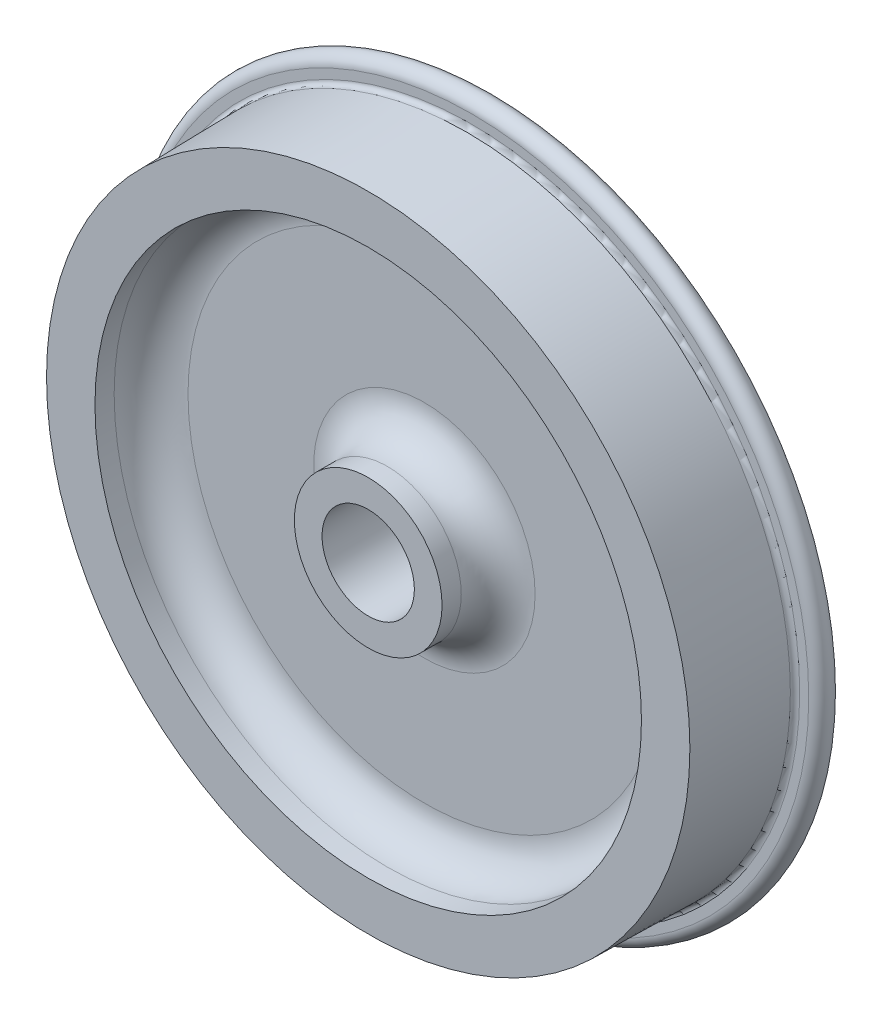
from build123d import *

# Parameters (mm, degrees)
SKETCH1_R                   = 58.42
BOSS_EXTRUDE1_DEPTH         = 13.97
SKETCH2_R                   = 46.99
SKETCH2_R_2                 = 12.7
CUT_EXTRUDE1_DEPTH          = 9.652
FILLET1_R                   = 6.35
SKETCH3_R                   = 60.96
BOSS_EXTRUDE2_DEPTH         = 7.62
SKETCH4_R                   = 7.9375
CUT_EXTRUDE2_DEPTH          = 89.872781548
SKETCH5_R                   = 60.96
SKETCH5_R_2                 = 58.42
FLANGEWIDTHMACHINED_DEPTH   = 3.81
SKETCH7_R                   = 58.42
SKETCH7_R_2                 = 55.5625
CUT_EXTRUDE5_DEPTH          = 17.78
SKETCH6_R                   = 60.96
SKETCH6_R_2                 = 59.8805
FLANGE_DEPTH_MACHINED_DEPTH = 89.024835132
DRAFT1_ANGLE                = 1
FILLET2_R                   = 0.8128
FILLET3_R                   = 1.905


with BuildPart() as part:
    # Sketch1 → Boss-Extrude1 (new body)
    with BuildSketch(Plane.XY):
        Circle(SKETCH1_R)
    extrude(amount=BOSS_EXTRUDE1_DEPTH)

    # Sketch2 → Cut-Extrude1 (cut)
    with BuildSketch(Plane.XY.offset(13.97)):
        Circle(SKETCH2_R)
        Circle(SKETCH2_R_2, mode=Mode.SUBTRACT)
    extrude(amount=-CUT_EXTRUDE1_DEPTH, mode=Mode.SUBTRACT)

    # Fillet1
    fillet1_edges = [part.edges().sort_by_distance(p)[0] for p in [
        (-46.99, 0, 4.318),
        (-12.7, 0, 4.318),
    ]]
    fillet(fillet1_edges, radius=FILLET1_R)

    # Sketch3 → Boss-Extrude2 (add)
    with BuildSketch(Plane(origin=(0, 0, 0), x_dir=(-1, 0, 0), z_dir=(0, 0, -1))):
        with Locations(Location((0, 0, 0), (0, 0, 180))):
            Circle(SKETCH3_R)
    extrude(amount=BOSS_EXTRUDE2_DEPTH)

    # Sketch4 → Cut-Extrude2 (cut, through all)
    with BuildSketch(Plane.XY.offset(13.97)):
        Circle(SKETCH4_R)
    extrude(amount=-CUT_EXTRUDE2_DEPTH, mode=Mode.SUBTRACT)

    # Sketch5 → FlangeWidthMachined (cut)
    with BuildSketch(Plane.XY):
        Circle(SKETCH5_R)
        Circle(SKETCH5_R_2, mode=Mode.SUBTRACT)
    extrude(amount=-FLANGEWIDTHMACHINED_DEPTH, mode=Mode.SUBTRACT)

    # Sketch7 → Cut-Extrude5 (cut)
    with BuildSketch(Plane.XY.offset(13.97)):
        Circle(SKETCH7_R)
        Circle(SKETCH7_R_2, mode=Mode.SUBTRACT)
    extrude(amount=-CUT_EXTRUDE5_DEPTH, mode=Mode.SUBTRACT)

    # Sketch6 → Flange Depth Machined (cut, through all)
    with BuildSketch(Plane.XY.offset(-3.81)):
        Circle(SKETCH6_R)
        Circle(SKETCH6_R_2, mode=Mode.SUBTRACT)
    extrude(amount=-FLANGE_DEPTH_MACHINED_DEPTH, mode=Mode.SUBTRACT)

    # Draft1
    draft1_faces = [part.faces().sort_by_distance(p)[0] for p in [
        (-55.5625, 0, 5.08),
    ]]
    draft(draft1_faces, Plane.XY, DRAFT1_ANGLE)

    # Fillet2
    fillet2_edges = [part.edges().sort_by_distance(p)[0] for p in [
        (-55.629003797, 0, -3.81),
    ]]
    fillet(fillet2_edges, radius=FILLET2_R)

    # Fillet3
    fillet3_edges = [part.edges().sort_by_distance(p)[0] for p in [
        (-59.8805, 0, -7.62),
        (-59.8805, 0, -3.81),
    ]]
    fillet(fillet3_edges, radius=FILLET3_R - 0.0001)  # a hair under: the kernel refuses the full size


solid = part.part
